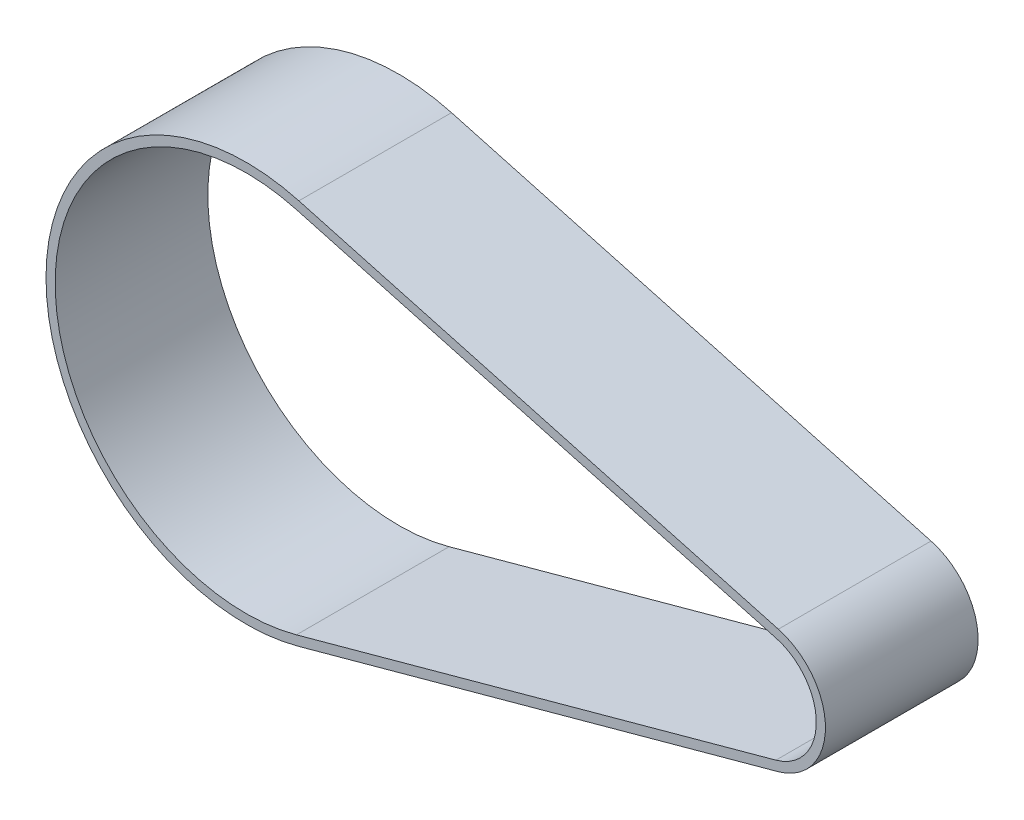
from build123d import *

# Parameters (mm, degrees)
BOSS_EXTRUDE1_DEPTH = 25


with BuildPart() as part:
    # Sketch1 → Boss-Extrude1 (new body)
    with BuildSketch(Plane.XY):
        with BuildLine():
            Line((-75.751935048, 31.597931802), (2.766522695, 10.108251688))
            ThreePointArc((2.766522695, 10.108251688), (10.48, 0), (2.766522695, -10.108251688))
            Line((2.766522695, -10.108251688), (-75.751935048, -31.597931802))
            ThreePointArc((-75.751935048, -31.597931802), (-117.15995828, 0), (-75.751935048, 31.597931802))
        make_face()
        with BuildLine():
            Line((-76.147906808, 30.151140053), (2.370550935, 8.661459938))
            ThreePointArc((2.370550935, 8.661459938), (8.98, 0), (2.370550935, -8.661459938))
            Line((2.370550935, -8.661459938), (-76.147906808, -30.151140053))
            ThreePointArc((-76.147906808, -30.151140053), (-115.65995828, 0), (-76.147906808, 30.151140053))
        make_face(mode=Mode.SUBTRACT)
    extrude(amount=BOSS_EXTRUDE1_DEPTH)


solid = part.part
